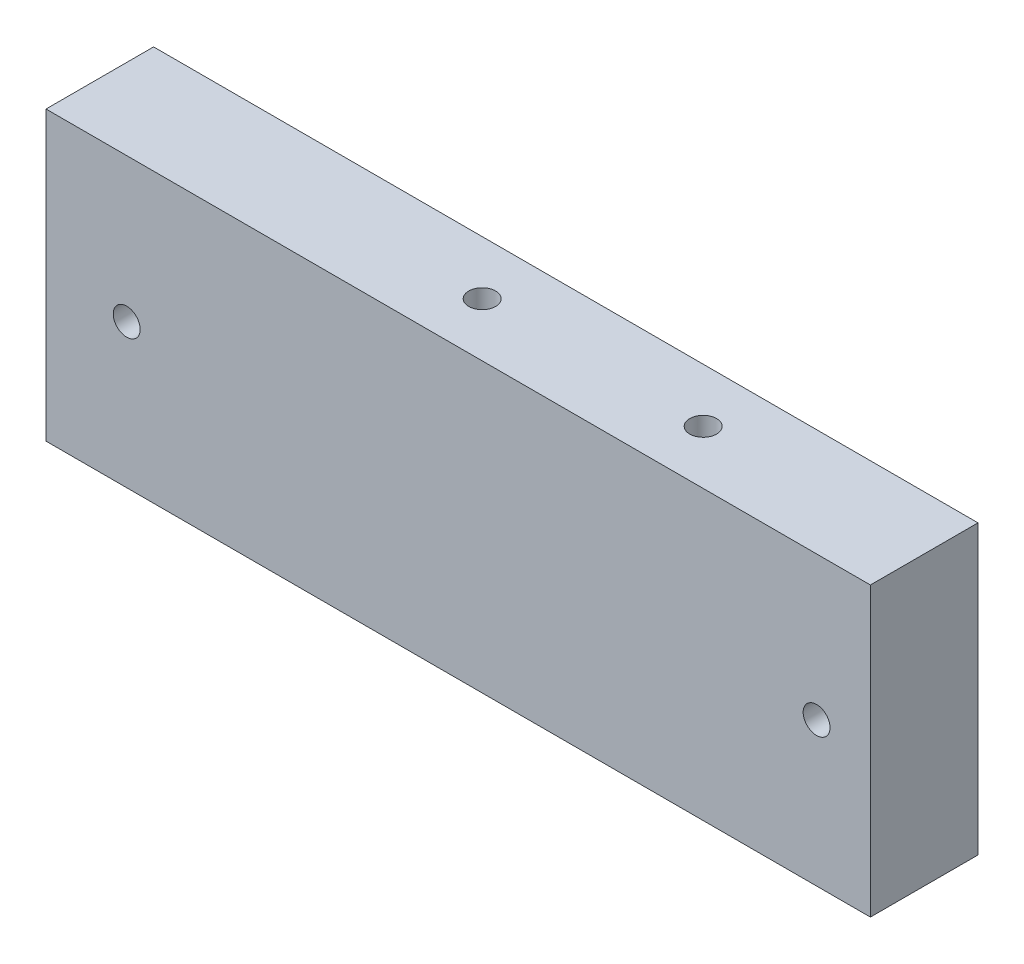
from build123d import *

# Parameters (mm, degrees)
SKETCH1_W           = 97.3
SKETCH1_H           = 33.95
BOSS_EXTRUDE1_DEPTH = 12.7
HOLE1_D             = 3.175
HOLE1_DEPTH         = 31.75
HOLE1_CSINK_D       = 10.16
HOLE1_CSINK_ANGLE   = 82
HOLE1_TIP           = 0.953866233
HOLE2_D             = 3.175
HOLE2_DEPTH         = 31.75
HOLE2_CSINK_D       = 10.16
HOLE2_CSINK_ANGLE   = 82
HOLE2_TIP           = 0.953866233
HOLE5_D             = 3.175
HOLE5_DEPTH         = 31.75
HOLE5_CSINK_D       = 10.16
HOLE5_CSINK_ANGLE   = 82
HOLE5_TIP           = 0.953866233
HOLE6_D             = 3.175
HOLE6_DEPTH         = 31.75
HOLE6_CSINK_D       = 10.16
HOLE6_CSINK_ANGLE   = 82
HOLE6_TIP           = 0.953866233


with BuildPart() as part:
    # Sketch1 → Boss-Extrude1 (new body)
    with BuildSketch(Plane.XY):
        with Locations((-292.654465963, -36.025)):
            Rectangle(SKETCH1_W, SKETCH1_H)
    extrude(amount=-BOSS_EXTRUDE1_DEPTH)

    # Hole1
    with Locations(Plane(origin=(-124.004465969, 0, -10.424290059), x_dir=(-1, 0, 0), z_dir=(0, 1, 0))):
        with Locations((126.349999994, 161.374290059), (146.083333327, 4.074290059), (172.166666661, 4.074290059), (126.349999994, 34.524290059), (126.349999994, 130.924290059), (-172.166666661, 4.074290059), (-146.083333327, 4.074290059), (-126.349999994, 34.524290059), (-126.349999994, 130.924290059), (-126.349999994, 161.374290059)):
            CounterSinkHole(HOLE1_D / 2, HOLE1_CSINK_D / 2, depth=HOLE1_DEPTH, counter_sink_angle=HOLE1_CSINK_ANGLE)
            with Locations((0, 0, -(HOLE1_DEPTH + HOLE1_TIP / 2))):  # 118° drill point
                Cone(0, HOLE1_D / 2, HOLE1_TIP, mode=Mode.SUBTRACT)

    # Hole2
    with Locations(Plane(origin=(-124.004465969, -72.05, -10.424290059), x_dir=(1, 0, 0), z_dir=(0, -1, 0))):
        with Locations((126.349999994, 161.374290059), (146.083333327, 4.074290059), (172.166666661, 4.074290059), (126.349999994, 34.524290059), (126.349999994, 130.924290059), (-172.166666661, 4.074290059), (-146.083333327, 4.074290059), (-126.349999994, 34.524290059), (-126.349999994, 130.924290059), (-126.349999994, 161.374290059)):
            CounterSinkHole(HOLE2_D / 2, HOLE2_CSINK_D / 2, depth=HOLE2_DEPTH, counter_sink_angle=HOLE2_CSINK_ANGLE)
            with Locations((0, 0, -(HOLE2_DEPTH + HOLE2_TIP / 2))):  # 118° drill point
                Cone(0, HOLE2_D / 2, HOLE2_TIP, mode=Mode.SUBTRACT)

    # Hole5
    with Locations(Plane(origin=(-124.004465969, -208.286738577, -12.7), x_dir=(-1, 0, 0), z_dir=(0, 0, -1))):
        with Locations((207.774999994, 172.261738577), (126.349999994, 172.261738577)):
            CounterSinkHole(HOLE5_D / 2, HOLE5_CSINK_D / 2, depth=HOLE5_DEPTH, counter_sink_angle=HOLE5_CSINK_ANGLE)
            with Locations((0, 0, -(HOLE5_DEPTH + HOLE5_TIP / 2))):  # 118° drill point
                Cone(0, HOLE5_D / 2, HOLE5_TIP, mode=Mode.SUBTRACT)

    # Hole6
    with Locations(Plane(origin=(-124.004465969, -6.35, -10.424290059), x_dir=(-1, 0, 0), z_dir=(0, 1, 0))):
        with Locations((-207.774999994, 333.02141023), (-207.774999994, 225.48903684), (-207.774999994, 137.424290059), (-172.166666661, 4.074290059), (-146.083333327, 4.074290059), (-94.599999994, 161.374290059), (0, 161.374290059), (94.599999994, 161.374290059), (146.083333327, 4.074290059), (172.166666661, 4.074290059), (207.774999994, 137.424290059), (207.774999994, 225.48903684), (207.774999994, 333.02141023), (166.795833328, 301.970350905), (40.979166666, 301.970350905), (-40.979166666, 301.970350905), (-166.795833328, 301.970350905), (0, 193.124290059), (0, 301.970350905), (0, 412.366411751), (-126.349999994, 106.824290059), (-126.349999994, 58.624290059), (126.349999994, 58.624290059), (126.349999994, 106.824290059)):
            CounterSinkHole(HOLE6_D / 2, HOLE6_CSINK_D / 2, depth=HOLE6_DEPTH, counter_sink_angle=HOLE6_CSINK_ANGLE)
            with Locations((0, 0, -(HOLE6_DEPTH + HOLE6_TIP / 2))):  # 118° drill point
                Cone(0, HOLE6_D / 2, HOLE6_TIP, mode=Mode.SUBTRACT)


solid = part.part
